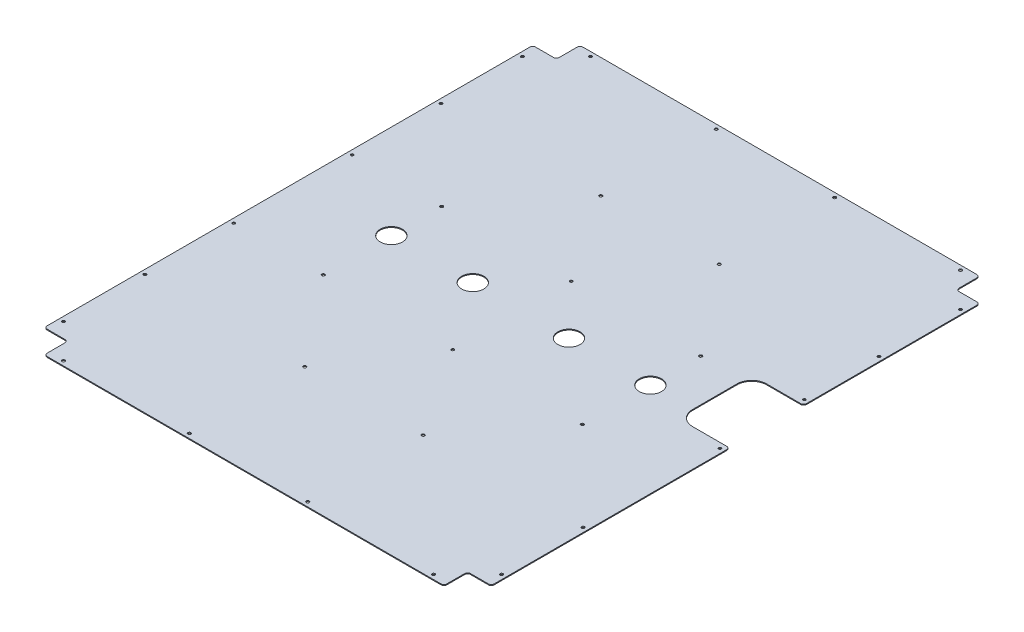
from build123d import *

# Parameters (mm, degrees)
SKETCH1_W            = 1510
SKETCH1_H            = 1810
BASE_FLANGE1_DEPTH   = 3.03784
CUT_EXTRUDE1_REACH   = 1180.584
SKETCH6_W            = 80
SKETCH6_H            = 80
M8_CLEARANCE_HOLE1_D = 10
FILLET1_R            = 10
FILLET1_OF_MIRROR1_R = 10
MIRROR2_START        = -3.03784
MIRROR2_OUTLINE_R    = 5
MIRROR2_DEPTH        = 3.03784
CUT_EXTRUDE2_REACH   = 1180.584
SKETCH12_R           = 37.5
M8_CLEARANCE_HOLE2_D = 9
FILLET2_R            = 10


# Read off the part's stored shape, not the designer's step: Mirror2
# Sheet-metal steps are written as plain solids
with BuildPart() as part:
    # Sketch1 → Base-Flange1 (new body)
    with BuildSketch(Plane(origin=(0, 0, 0), x_dir=(1, 0, 0), z_dir=(0, 1, 0))):
        Rectangle(SKETCH1_W, SKETCH1_H)
    extrude(amount=-BASE_FLANGE1_DEPTH)

    # Sketch6 → Cut-Extrude1 (cut, up to next)
    with BuildSketch(Plane(origin=(0, 0, 0), x_dir=(1, 0, 0), z_dir=(0, 1, 0)), mode=Mode.PRIVATE) as cut_extrude1_sk1:
        with Locations((-715, 865)):
            Rectangle(SKETCH6_W, SKETCH6_H)
    cut_extrude1_tool1 = extrude(cut_extrude1_sk1.sketch, amount=-CUT_EXTRUDE1_REACH, mode=Mode.PRIVATE) & part.part
    cut_extrude1 = cut_extrude1_tool1.solids().sort_by_distance((-715, 0, -865))[0]
    add(cut_extrude1, mode=Mode.SUBTRACT)

    # M8 Clearance Hole1 (through all)
    with Locations(Plane(origin=(0, -3.03784, 0), x_dir=(-1, 0, 0), z_dir=(0, -1, 0))):
        with Locations((200, 890), (200, 500), (740, 500), (740, 775), (625, 890), (437.5, 200)):
            m8_clearance_hole1 = Hole(M8_CLEARANCE_HOLE1_D / 2)

    # Fillet1
    fillet1_edges = [part.edges().sort_by_distance(p)[0] for p in [
        (-755, -1.51892, -825),
        (-675, -1.51892, -905),
        (-675, -1.51892, -825),
    ]]
    fillet(fillet1_edges, radius=FILLET1_R)

    # Mirror1: Cut-Extrude1, M8 Clearance Hole1 across plane
    add(cut_extrude1.mirror(Plane.XY), mode=Mode.SUBTRACT)
    add(m8_clearance_hole1.mirror(Plane.XY), mode=Mode.SUBTRACT)

    # Fillet1 of Mirror1
    fillet1_of_mirror1_edges = [part.edges().sort_by_distance(p)[0] for p in [
        (-755, -1.51892, 825),
        (-675, -1.51892, 905),
        (-675, -1.51892, 825),
    ]]
    fillet(fillet1_of_mirror1_edges, radius=FILLET1_OF_MIRROR1_R)

    # Mirror2 outline → Mirror2 (cut)
    with BuildSketch(Plane(origin=(0, 0, 0), x_dir=(1, 0, 0), z_dir=(0, 1, 0)).offset(MIRROR2_START)):
        with BuildLine():
            ThreePointArc((675, 835), (677.928932188, 827.928932188), (685, 825))
            Line((685, 825), (745, 825))
            ThreePointArc((745, 825), (752.071067812, 822.071067812), (755, 815))
            Line((755, 815), (755, 905))
            Line((755, 905), (665, 905))
            ThreePointArc((665, 905), (672.071067812, 902.071067812), (675, 895))
            Line((675, 895), (675, 835))
        make_face()
        with BuildLine():
            Line((755, -905), (755, -815))
            ThreePointArc((755, -815), (752.071067812, -822.071067812), (745, -825))
            Line((745, -825), (685, -825))
            ThreePointArc((685, -825), (677.928932188, -827.928932188), (675, -835))
            Line((675, -835), (675, -895))
            ThreePointArc((675, -895), (672.071067812, -902.071067812), (665, -905))
            Line((665, -905), (755, -905))
        make_face()
        with Locations((200, -890)):
            Circle(MIRROR2_OUTLINE_R)
        with Locations((200, 890)):
            Circle(MIRROR2_OUTLINE_R)
        with Locations((437.5, -200)):
            Circle(MIRROR2_OUTLINE_R)
        with Locations((437.5, 200)):
            Circle(MIRROR2_OUTLINE_R)
        with Locations((625, -890)):
            Circle(MIRROR2_OUTLINE_R)
        with Locations((625, 890)):
            Circle(MIRROR2_OUTLINE_R)
        with Locations((740, -775)):
            Circle(MIRROR2_OUTLINE_R)
        with Locations((740, 775)):
            Circle(MIRROR2_OUTLINE_R)
        with Locations((740, -500)):
            Circle(MIRROR2_OUTLINE_R)
        with Locations((740, 500)):
            Circle(MIRROR2_OUTLINE_R)
        with Locations((200, -500)):
            Circle(MIRROR2_OUTLINE_R)
        with Locations((200, 500)):
            Circle(MIRROR2_OUTLINE_R)
    extrude(amount=MIRROR2_DEPTH, mode=Mode.SUBTRACT)

    # Sketch12 → Cut-Extrude2 (cut, up to next)
    with BuildSketch(Plane.XZ.offset(3.03784), mode=Mode.PRIVATE) as cut_extrude2_sk1:
        with Locations(Location((-437.5, -30, 0), (0, 0, 270))):
            Circle(SKETCH12_R)
    cut_extrude2_tool1 = extrude(cut_extrude2_sk1.sketch, amount=-CUT_EXTRUDE2_REACH, mode=Mode.PRIVATE) & part.part
    # Sketch12 → Cut-Extrude2 (cut, up to next)
    with BuildSketch(Plane.XZ.offset(3.03784), mode=Mode.PRIVATE) as cut_extrude2_sk2:
        with Locations(Location((-162.5, -30, 0), (0, 0, 270))):
            Circle(SKETCH12_R)
    cut_extrude2_tool2 = extrude(cut_extrude2_sk2.sketch, amount=-CUT_EXTRUDE2_REACH, mode=Mode.PRIVATE) & part.part
    # Sketch12 → Cut-Extrude2 (cut, up to next)
    with BuildSketch(Plane.XZ.offset(3.03784), mode=Mode.PRIVATE) as cut_extrude2_sk3:
        with Locations(Location((162.5, -30, 0), (0, 0, 270))):
            Circle(SKETCH12_R)
    cut_extrude2_tool3 = extrude(cut_extrude2_sk3.sketch, amount=-CUT_EXTRUDE2_REACH, mode=Mode.PRIVATE) & part.part
    # Sketch12 → Cut-Extrude2 (cut, up to next)
    with BuildSketch(Plane.XZ.offset(3.03784), mode=Mode.PRIVATE) as cut_extrude2_sk4:
        with Locations(Location((437.5, -30, 0), (0, 0, 270))):
            Circle(SKETCH12_R)
    cut_extrude2_tool4 = extrude(cut_extrude2_sk4.sketch, amount=-CUT_EXTRUDE2_REACH, mode=Mode.PRIVATE) & part.part
    # Sketch12 → Cut-Extrude2 (cut, up to next)
    with BuildSketch(Plane.XZ.offset(3.03784), mode=Mode.PRIVATE) as cut_extrude2_sk5:
        with BuildLine():
            Line((755, 20), (630, 20))
            ThreePointArc((630, 20), (594.644660941, 5.355339059), (580, -30))
            Line((580, -30), (580, -180))
            ThreePointArc((580, -180), (594.644660941, -215.355339059), (630, -230))
            Line((630, -230), (755, -230))
            Line((755, -230), (755, 20))
        make_face()
    cut_extrude2_tool5 = extrude(cut_extrude2_sk5.sketch, amount=-CUT_EXTRUDE2_REACH, mode=Mode.PRIVATE) & part.part
    add(cut_extrude2_tool1.solids().sort_by_distance((-437.5, -3.03784, -30))[0], mode=Mode.SUBTRACT)
    add(cut_extrude2_tool2.solids().sort_by_distance((-162.5, -3.03784, -30))[0], mode=Mode.SUBTRACT)
    add(cut_extrude2_tool3.solids().sort_by_distance((162.5, -3.03784, -30))[0], mode=Mode.SUBTRACT)
    add(cut_extrude2_tool4.solids().sort_by_distance((437.5, -3.03784, -30))[0], mode=Mode.SUBTRACT)
    add(cut_extrude2_tool5.solids().sort_by_distance((669.419173, -3.03784, -105))[0], mode=Mode.SUBTRACT)

    # M8 Clearance Hole2 (through all)
    with Locations(Plane(origin=(0, -3.03784, 0), x_dir=(-1, 0, 0), z_dir=(0, -1, 0))):
        with Locations((-740, -37.5), (-740, 247.5), (740, 200), (740, -200), (0, 200), (0, -200)):
            Hole(M8_CLEARANCE_HOLE2_D / 2)

    # Fillet2
    fillet2_edges = [part.edges().sort_by_distance(p)[0] for p in [
        (755, -1.51892, 20),
        (755, -1.51892, -230),
    ]]
    fillet(fillet2_edges, radius=FILLET2_R)


solid = part.part
